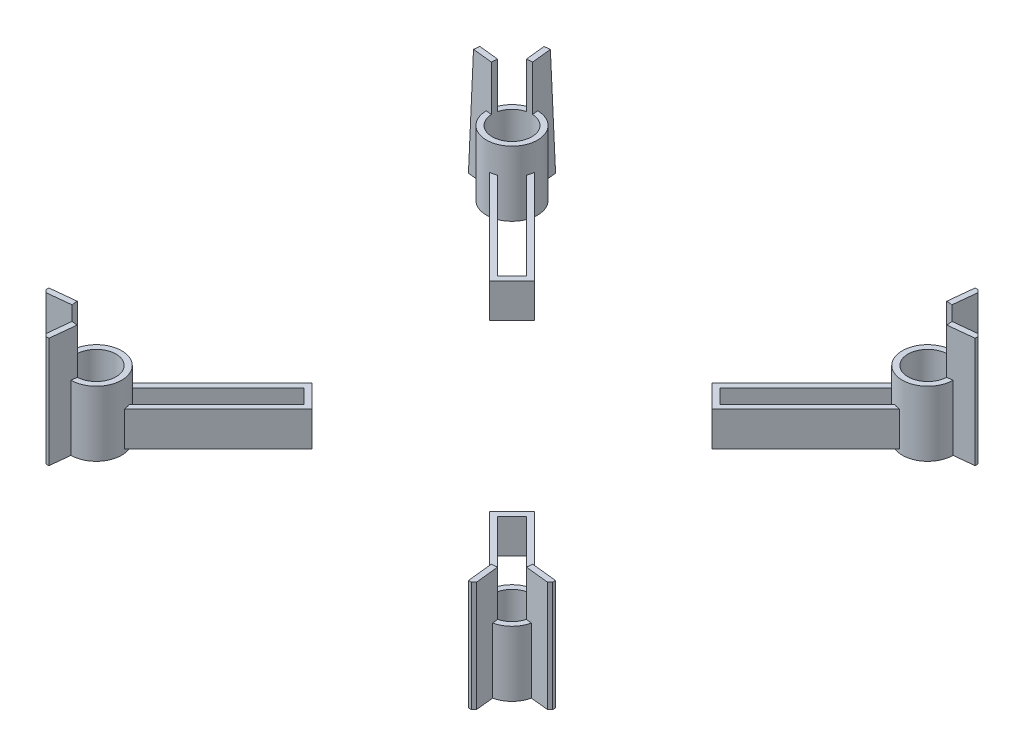
from build123d import *

# Parameters (mm, degrees)
SKETCH2_R               = 3.104394748
BOSS_EXTRUDE1_DEPTH     = 10.22
BOSS_EXTRUDE1_2_DEPTH   = 10.22
BOSS_EXTRUDE1_3_DEPTH   = 10.22
BOSS_EXTRUDE1_4_DEPTH   = 10.22
BOSS_EXTRUDE2_DEPTH     = 7.12
BOSS_EXTRUDE3_START     = -5.44
BOSS_EXTRUDE3_DEPTH     = 5.44
BOSS_EXTRUDE3_2_DEPTH   = 5.44
BOSS_EXTRUDE3_3_DEPTH   = 5.44
BOSS_EXTRUDE3_4_DEPTH   = 5.44
CUT_EXTRUDE2_DEPTH      = 83.406657099
CUT_EXTRUDE2_DEPTH_BACK = 83.406657099
CUT_EXTRUDE3_DEPTH      = 83.406657099
CUT_EXTRUDE3_DEPTH_BACK = 83.406657099


# Read off the part's stored shape, not the designer's step: Boss-Extrude3
with BuildPart() as part:
    # Sketch2 → Boss-Extrude1 (new body)
    with BuildSketch(Plane(origin=(0, 0, 0), x_dir=(1, 0, 0), z_dir=(0, 1, 0))):
        with BuildLine():
            Line((-36.56808357, 33.521240003), (-39.389348261, 33.81770357))
            Line((-39.389348261, 33.81770357), (-39.798800006, 33.408251825))
            Line((-39.798800006, 33.408251825), (-39.799120802, 32.955807865))
            Line((-39.799120802, 32.955807865), (-36.662139324, 32.62616821))
            ThreePointArc((-36.662139324, 32.62616821), (-29.826335384, 29.826335384), (-32.62616821, 36.662139324))
            Line((-32.62616821, 36.662139324), (-32.955807865, 39.799120802))
            Line((-32.955807865, 39.799120802), (-33.408251825, 39.798800006))
            Line((-33.408251825, 39.798800006), (-33.81770357, 39.389348261))
            Line((-33.81770357, 39.389348261), (-33.521240003, 36.56808357))
            ThreePointArc((-33.521240003, 36.56808357), (-35.489404747, 35.489404747), (-36.56808357, 33.521240003))
        make_face()
        with Locations(Location((-32.657870065, 32.657870065, 0), (0, 0, 270))):
            Circle(SKETCH2_R, mode=Mode.SUBTRACT)
    extrude(amount=BOSS_EXTRUDE1_DEPTH)



with BuildPart() as body_2:
    # Sketch2 → Boss-Extrude1 2 (new body)
    with BuildSketch(Plane(origin=(0, 0, 0), x_dir=(1, 0, 0), z_dir=(0, 1, 0))):
        with BuildLine():
            Line((33.521240003, 36.56808357), (33.81770357, 39.389348261))
            Line((33.81770357, 39.389348261), (33.408251825, 39.798800006))
            Line((33.408251825, 39.798800006), (32.955807865, 39.799120802))
            Line((32.955807865, 39.799120802), (32.62616821, 36.662139324))
            ThreePointArc((32.62616821, 36.662139324), (29.826335384, 29.826335384), (36.662139324, 32.62616821))
            Line((36.662139324, 32.62616821), (39.799120802, 32.955807865))
            Line((39.799120802, 32.955807865), (39.798800006, 33.408251825))
            Line((39.798800006, 33.408251825), (39.389348261, 33.81770357))
            Line((39.389348261, 33.81770357), (36.56808357, 33.521240003))
            ThreePointArc((36.56808357, 33.521240003), (35.489404747, 35.489404747), (33.521240003, 36.56808357))
        make_face()
        with Locations(Location((32.657870065, 32.657870065, 0), (0, 0, 270))):
            Circle(SKETCH2_R, mode=Mode.SUBTRACT)
    extrude(amount=BOSS_EXTRUDE1_2_DEPTH)


with BuildPart() as body_3:
    # Sketch2 → Boss-Extrude1 3 (new body)
    with BuildSketch(Plane(origin=(0, 0, 0), x_dir=(1, 0, 0), z_dir=(0, 1, 0))):
        with BuildLine():
            Line((36.56808357, -33.521240003), (39.389348261, -33.81770357))
            Line((39.389348261, -33.81770357), (39.798800006, -33.408251825))
            Line((39.798800006, -33.408251825), (39.799120802, -32.955807865))
            Line((39.799120802, -32.955807865), (36.662139324, -32.62616821))
            ThreePointArc((36.662139324, -32.62616821), (29.826335384, -29.826335384), (32.62616821, -36.662139324))
            Line((32.62616821, -36.662139324), (32.955807865, -39.799120802))
            Line((32.955807865, -39.799120802), (33.408251825, -39.798800006))
            Line((33.408251825, -39.798800006), (33.81770357, -39.389348261))
            Line((33.81770357, -39.389348261), (33.521240003, -36.56808357))
            ThreePointArc((33.521240003, -36.56808357), (35.489404747, -35.489404747), (36.56808357, -33.521240003))
        make_face()
        with Locations(Location((32.657870065, -32.657870065, 0), (0, 0, 270))):
            Circle(SKETCH2_R, mode=Mode.SUBTRACT)
    extrude(amount=BOSS_EXTRUDE1_3_DEPTH)


with BuildPart() as body_4:
    # Sketch2 → Boss-Extrude1 4 (new body)
    with BuildSketch(Plane(origin=(0, 0, 0), x_dir=(1, 0, 0), z_dir=(0, 1, 0))):
        with BuildLine():
            Line((-33.521240003, -36.56808357), (-33.81770357, -39.389348261))
            Line((-33.81770357, -39.389348261), (-33.408251825, -39.798800006))
            Line((-33.408251825, -39.798800006), (-32.955807865, -39.799120802))
            Line((-32.955807865, -39.799120802), (-32.62616821, -36.662139324))
            ThreePointArc((-32.62616821, -36.662139324), (-29.826335384, -29.826335384), (-36.662139324, -32.62616821))
            Line((-36.662139324, -32.62616821), (-39.799120802, -32.955807865))
            Line((-39.799120802, -32.955807865), (-39.798800006, -33.408251825))
            Line((-39.798800006, -33.408251825), (-39.389348261, -33.81770357))
            Line((-39.389348261, -33.81770357), (-36.56808357, -33.521240003))
            ThreePointArc((-36.56808357, -33.521240003), (-35.489404747, -35.489404747), (-33.521240003, -36.56808357))
        make_face()
        with Locations(Location((-32.657870065, -32.657870065, 0), (0, 0, 270))):
            Circle(SKETCH2_R, mode=Mode.SUBTRACT)
    extrude(amount=BOSS_EXTRUDE1_4_DEPTH)


with BuildPart() as part_1:
    add(part.part)

    add(body_2.part)  # Boss-Extrude2 merges body 2

    add(body_3.part)  # Boss-Extrude2 merges body 3

    add(body_4.part)  # Boss-Extrude2 merges body 4
    # Sketch3 → Boss-Extrude2 (add)
    with BuildSketch(Plane(origin=(0, 10.22, 0), x_dir=(1, 0, 0), z_dir=(0, 1, 0))):
        with BuildLine():
            Line((-39.389348261, 33.81770357), (-35.665629274, 33.426408483))
            ThreePointArc((-35.665629274, 33.426408483), (-35.745265815, 32.982299163), (-35.759685027, 32.531336689))
            Line((-35.759685027, 32.531336689), (-39.799120802, 32.955807865))
            Line((-39.799120802, 32.955807865), (-39.798800006, 33.408251825))
            Line((-39.798800006, 33.408251825), (-39.389348261, 33.81770357))
        make_face()
        with BuildLine():
            Line((-32.955807865, 39.799120802), (-32.531336689, 35.759685027))
            ThreePointArc((-32.531336689, 35.759685027), (-32.982299163, 35.745265815), (-33.426408483, 35.665629274))
            Line((-33.426408483, 35.665629274), (-33.81770357, 39.389348261))
            Line((-33.81770357, 39.389348261), (-33.408251825, 39.798800006))
            Line((-33.408251825, 39.798800006), (-32.955807865, 39.799120802))
        make_face()
        with BuildLine():
            Line((33.81770357, 39.389348261), (33.426408483, 35.665629274))
            ThreePointArc((33.426408483, 35.665629274), (32.982299163, 35.745265815), (32.531336689, 35.759685027))
            Line((32.531336689, 35.759685027), (32.955807865, 39.799120802))
            Line((32.955807865, 39.799120802), (33.408251825, 39.798800006))
            Line((33.408251825, 39.798800006), (33.81770357, 39.389348261))
        make_face()
        with BuildLine():
            Line((39.799120802, 32.955807865), (35.759685027, 32.531336689))
            ThreePointArc((35.759685027, 32.531336689), (35.745265815, 32.982299163), (35.665629274, 33.426408483))
            Line((35.665629274, 33.426408483), (39.389348261, 33.81770357))
            Line((39.389348261, 33.81770357), (39.798800006, 33.408251825))
            Line((39.798800006, 33.408251825), (39.799120802, 32.955807865))
        make_face()
        with BuildLine():
            Line((39.389348261, -33.81770357), (35.665629274, -33.426408483))
            ThreePointArc((35.665629274, -33.426408483), (35.745265815, -32.982299163), (35.759685027, -32.531336689))
            Line((35.759685027, -32.531336689), (39.799120802, -32.955807865))
            Line((39.799120802, -32.955807865), (39.798800006, -33.408251825))
            Line((39.798800006, -33.408251825), (39.389348261, -33.81770357))
        make_face()
        with BuildLine():
            Line((32.955807865, -39.799120802), (32.531336689, -35.759685027))
            ThreePointArc((32.531336689, -35.759685027), (32.982299163, -35.745265815), (33.426408483, -35.665629274))
            Line((33.426408483, -35.665629274), (33.81770357, -39.389348261))
            Line((33.81770357, -39.389348261), (33.408251825, -39.798800006))
            Line((33.408251825, -39.798800006), (32.955807865, -39.799120802))
        make_face()
        with BuildLine():
            Line((-33.81770357, -39.389348261), (-33.426408483, -35.665629274))
            ThreePointArc((-33.426408483, -35.665629274), (-32.982299163, -35.745265815), (-32.531336689, -35.759685027))
            Line((-32.531336689, -35.759685027), (-32.955807865, -39.799120802))
            Line((-32.955807865, -39.799120802), (-33.408251825, -39.798800006))
            Line((-33.408251825, -39.798800006), (-33.81770357, -39.389348261))
        make_face()
        with BuildLine():
            Line((-39.799120802, -32.955807865), (-35.759685027, -32.531336689))
            ThreePointArc((-35.759685027, -32.531336689), (-35.745265815, -32.982299163), (-35.665629274, -33.426408483))
            Line((-35.665629274, -33.426408483), (-39.389348261, -33.81770357))
            Line((-39.389348261, -33.81770357), (-39.798800006, -33.408251825))
            Line((-39.798800006, -33.408251825), (-39.799120802, -32.955807865))
        make_face()
    extrude(amount=BOSS_EXTRUDE2_DEPTH)

    # Boss-Extrude3 4 outline → Boss-Extrude3 4 (add)
    with BuildSketch(Plane(origin=(0, 0.60000007, 0), x_dir=(-1, 0, 0), z_dir=(0, -1, 0)).offset(BOSS_EXTRUDE3_START)):
        with BuildLine():
            Line((17.46921643, 15.206474617), (15.206474617, 17.46921643))
            Line((15.206474617, 17.46921643), (28.930812636, 31.193554449))
            ThreePointArc((28.930812636, 31.193554449), (28.770884193, 31.695311947), (28.678183425, 32.213717445))
            Line((28.678183425, 32.213717445), (13.93368241, 17.46921643))
            Line((13.93368241, 17.46921643), (17.46921643, 13.93368241))
            Line((17.46921643, 13.93368241), (32.213717445, 28.678183425))
            ThreePointArc((32.213717445, 28.678183425), (31.695311947, 28.770884193), (31.193554449, 28.930812636))
            Line((31.193554449, 28.930812636), (17.46921643, 15.206474617))
        make_face()
    extrude(amount=BOSS_EXTRUDE3_4_DEPTH)

    # Sketch7 → Cut-Extrude2 (cut, two sides: drawn at the far end of the back side and taken through both)
    with BuildSketch(Plane(origin=(-28.459390838, 0, 2.990563969), x_dir=(-0.10450639299140999, 0, -0.9945242148001853), z_dir=(0.9945242148001854, 0, -0.10450639299140999)).offset(-CUT_EXTRUDE2_DEPTH_BACK)):
        Polygon((52.877921967, -186.703123885), (43.025281973, 0), (42.110220811, 17.34), (32.257580818, 204.043123885), (405.663828588, 223.748403873), (426.284169737, -166.997843898), align=None)
    extrude(amount=CUT_EXTRUDE2_DEPTH + CUT_EXTRUDE2_DEPTH_BACK, mode=Mode.SUBTRACT)

    # Sketch8 → Cut-Extrude3 (cut, two sides: drawn at the far end of the back side and taken through both)
    with BuildSketch(Plane(origin=(2.990563969, 0, -28.459390838), x_dir=(0.9945242148001855, 0, 0.10450639299140776), z_dir=(-0.10450639299140778, 0, 0.9945242148001856)).offset(-CUT_EXTRUDE3_DEPTH_BACK)):
        Polygon((-52.655564798, -186.714725279), (-43.025281973, 0), (-42.130927744, 17.34), (-32.50064492, 204.054725279), (-405.930095478, 223.315290927), (-426.085015356, -167.454159631), align=None)
    extrude(amount=CUT_EXTRUDE3_DEPTH + CUT_EXTRUDE3_DEPTH_BACK, mode=Mode.SUBTRACT)


with BuildPart() as body_2_2:
    # Boss-Extrude3 outline → Boss-Extrude3 (new body)
    with BuildSketch(Plane(origin=(0, 0.60000007, 0), x_dir=(-1, 0, 0), z_dir=(0, -1, 0)).offset(BOSS_EXTRUDE3_START)):
        with BuildLine():
            ThreePointArc((-31.193554449, 28.930812636), (-31.695311946, 28.770884193), (-32.213717445, 28.678183426))
            Line((-32.213717445, 28.678183426), (-17.46921643, 13.93368241))
            Line((-17.46921643, 13.93368241), (-13.93368241, 17.46921643))
            Line((-13.93368241, 17.46921643), (-28.678183426, 32.213717445))
            ThreePointArc((-28.678183426, 32.213717445), (-28.770884193, 31.695311946), (-28.930812636, 31.193554449))
            Line((-28.930812636, 31.193554449), (-15.206474617, 17.46921643))
            Line((-15.206474617, 17.46921643), (-17.46921643, 15.206474617))
            Line((-17.46921643, 15.206474617), (-31.193554449, 28.930812636))
        make_face()
    extrude(amount=BOSS_EXTRUDE3_DEPTH)


with BuildPart() as body_3_2:
    # Boss-Extrude3 2 outline → Boss-Extrude3 2 (new body)
    with BuildSketch(Plane(origin=(0, 0.60000007, 0), x_dir=(-1, 0, 0), z_dir=(0, -1, 0)).offset(BOSS_EXTRUDE3_START)):
        with BuildLine():
            ThreePointArc((-28.930812636, -31.193554449), (-28.770884193, -31.695311946), (-28.678183426, -32.213717445))
            Line((-28.678183426, -32.213717445), (-13.93368241, -17.46921643))
            Line((-13.93368241, -17.46921643), (-17.46921643, -13.93368241))
            Line((-17.46921643, -13.93368241), (-32.213717445, -28.678183426))
            ThreePointArc((-32.213717445, -28.678183426), (-31.695311946, -28.770884193), (-31.193554449, -28.930812636))
            Line((-31.193554449, -28.930812636), (-17.46921643, -15.206474617))
            Line((-17.46921643, -15.206474617), (-15.206474617, -17.46921643))
            Line((-15.206474617, -17.46921643), (-28.930812636, -31.193554449))
        make_face()
    extrude(amount=BOSS_EXTRUDE3_2_DEPTH)


with BuildPart() as body_4_2:
    # Boss-Extrude3 3 outline → Boss-Extrude3 3 (new body)
    with BuildSketch(Plane(origin=(0, 0.60000007, 0), x_dir=(-1, 0, 0), z_dir=(0, -1, 0)).offset(BOSS_EXTRUDE3_START)):
        with BuildLine():
            ThreePointArc((31.193554449, -28.930812636), (31.695311946, -28.770884193), (32.213717445, -28.678183426))
            Line((32.213717445, -28.678183426), (17.46921643, -13.93368241))
            Line((17.46921643, -13.93368241), (13.93368241, -17.46921643))
            Line((13.93368241, -17.46921643), (28.678183426, -32.213717445))
            ThreePointArc((28.678183426, -32.213717445), (28.770884193, -31.695311946), (28.930812636, -31.193554449))
            Line((28.930812636, -31.193554449), (15.206474617, -17.46921643))
            Line((15.206474617, -17.46921643), (17.46921643, -15.206474617))
            Line((17.46921643, -15.206474617), (31.193554449, -28.930812636))
        make_face()
    extrude(amount=BOSS_EXTRUDE3_3_DEPTH)


solid = Compound([part_1.part, body_2_2.part, body_3_2.part, body_4_2.part])
